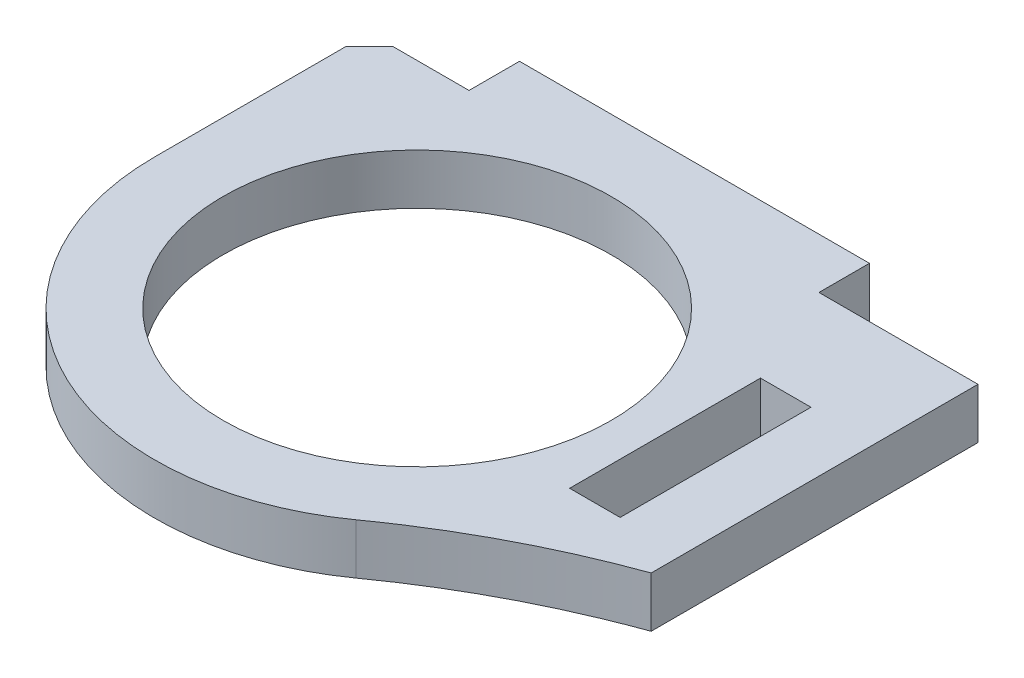
from build123d import *

# Parameters (mm, degrees)
BOSS_EXTRUDE1_DEPTH = 3.175
SKETCH2_W           = 3.175
SKETCH2_H           = 14
BOSS_EXTRUDE2_DEPTH = 3.175
BOSS_EXTRUDE3_DEPTH = 3.175
CUT_EXTRUDE2_START  = -10
CUT_EXTRUDE2_DEPTH  = 10
FILLET1_R           = 50
SKETCH6_W           = 6.875
SKETCH6_H           = 3.175
BOSS_EXTRUDE5_DEPTH = 3.11351312
SKETCH7_W           = 11.175
SKETCH7_H           = 3.175
SKETCH7_W_2         = 4.3
CUT_EXTRUDE3_DEPTH  = 5.11351312
BOSS_EXTRUDE6_START = -3.175
BOSS_EXTRUDE6_DEPTH = 3.175
SKETCH9_W           = 3.175
SKETCH9_H           = 14
BOSS_EXTRUDE7_DEPTH = 3.175
SKETCH10_W          = 3.175
SKETCH10_H          = 12
CUT_EXTRUDE4_DEPTH  = 3.175
CUT_EXTRUDE5_DEPTH  = 10
SKETCH14_W          = 22
SKETCH14_H          = 3.175
BOSS_EXTRUDE8_DEPTH = 3.175
CHAMFER1_SIZE       = 1.5


with BuildPart() as part:
    # Sketch1 → Boss-Extrude1 (new body)
    with BuildSketch(Plane(origin=(0, 0, 0), x_dir=(1, 0, 0), z_dir=(0, 1, 0))):
        with BuildLine():
            ThreePointArc((-16.5, 0), (0, -16.5), (16.5, 0))
            Line((16.5, 0), (16.5, 18.61351312))
            Line((16.5, 18.61351312), (12.2, 18.61351312))
            Line((12.2, 18.61351312), (12.2, 0))
            ThreePointArc((12.2, 0), (0, -12.2), (-12.2, 0))
            Line((-12.2, 0), (-12.2, 18))
            Line((-12.2, 18), (-16.5, 18))
            Line((-16.5, 18), (-16.5, 0))
        make_face()
    extrude(amount=BOSS_EXTRUDE1_DEPTH)

    # Sketch2 → Boss-Extrude2 (add)
    with BuildSketch(Plane(origin=(0, 3.175, 0), x_dir=(1, 0, 0), z_dir=(0, 1, 0))):
        with BuildLine():
            Line((15.2, -3.034798181), (15.2, -4.5))
            Line((15.2, -4.5), (15.874507866, -4.5))
            Line((15.874507866, -4.5), (23.375, -4.5))
            Line((23.375, -4.5), (23.375, 15.5))
            Line((23.375, 15.5), (15.2, 15.5))
            Line((15.2, 15.5), (15.2, 3.034798181))
            ThreePointArc((15.2, 3.034798181), (15.424817665, 1.524795068), (15.5, 0))
            ThreePointArc((15.5, 0), (15.424817665, -1.524795068), (15.2, -3.034798181))
        make_face()
        with Locations((18.0875, 4.5)):
            Rectangle(SKETCH2_W, SKETCH2_H, mode=Mode.SUBTRACT)
    extrude(amount=-BOSS_EXTRUDE2_DEPTH)

    # Sketch3 → Boss-Extrude3 (add)
    with BuildSketch(Plane(origin=(0, 0, 0), x_dir=(-1, 0, 0), z_dir=(0, -1, 0))):
        with BuildLine():
            Line((-23.375, -16.5), (0, -16.5))
            ThreePointArc((0, -16.5), (-9.949874371, -13.162446581), (-15.874507866, -4.5))
            Line((-15.874507866, -4.5), (-23.375, -4.5))
            Line((-23.375, -4.5), (-23.375, -16.5))
        make_face()
    extrude(amount=-BOSS_EXTRUDE3_DEPTH)

    # Sketch5 → Cut-Extrude2 (cut)
    with BuildSketch(Plane(origin=(0, 3.175, 0), x_dir=(1, 0, 0), z_dir=(0, 1, 0)).offset(CUT_EXTRUDE2_START)):
        with BuildLine():
            Line((23.375, -6.5), (19.675, -6.5))
            Line((19.675, -6.5), (17.491400843, -6.5))
            Line((17.491400843, -6.5), (15.165750888, -6.5))
            ThreePointArc((15.165750888, -6.5), (9.082951062, -13.774977314), (0, -16.5))
            Line((0, -16.5), (12.165525061, -16.5))
            Line((12.165525061, -16.5), (23.375, -16.5))
            Line((23.375, -16.5), (23.375, -6.5))
        make_face()
    extrude(amount=CUT_EXTRUDE2_DEPTH, mode=Mode.SUBTRACT)

    # Fillet1
    # the kernel refuses this fillet: 50 mm, written as the material it adds along each edge
    with BuildSketch(Plane(origin=(15.165750888, 0, 6.5), x_dir=(-0.6269455789999085, 0, 0.7790630532713443), z_dir=(0, 1, 0))) as fillet1_piece_1:
        with BuildLine():
            CenterArc((22.355625569, 48.152189259), FILLET1_R, 236.629724146, 17.744988352)
            Line((-5.146752438, 6.395522678), (-5.696799998, 5.560389347))
            ThreePointArc((-5.696799998, 5.560389347), (-3.352439272, 2.57081576), (-0.779063053, -0.626945579))
            Line((-0.779063053, -0.626945579), (0.269344886, -0.963043785))
            ThreePointArc((0.269344886, -0.963043785), (4.444190625, -0.390222456), (8.619036364, -0.963043785))
            Line((8.619036364, -0.963043785), (8.88838125, 0))
        make_face()
    extrude(amount=3.175)

    # Sketch6 → Boss-Extrude5 (add)
    with BuildSketch(Plane(origin=(0, 0, -15.5), x_dir=(-1, 0, 0), z_dir=(0, 0, -1))):
        with Locations((-19.9375, 1.5875)):
            Rectangle(SKETCH6_W, SKETCH6_H)
    extrude(amount=BOSS_EXTRUDE5_DEPTH)

    # Sketch7 → Cut-Extrude3 (cut)
    with BuildSketch(Plane(origin=(0, 0, -18.61351312), x_dir=(-1, 0, 0), z_dir=(0, 0, -1))):
        with Locations((-17.7875, 1.5875)):
            Rectangle(SKETCH7_W, SKETCH7_H)
        with Locations((14.35, 1.5875)):
            Rectangle(SKETCH7_W_2, SKETCH7_H)
    extrude(amount=-CUT_EXTRUDE3_DEPTH, mode=Mode.SUBTRACT)

    # Sketch8 → Boss-Extrude6 (add)
    with BuildSketch(Plane(origin=(0, 3.175, 0), x_dir=(1, 0, 0), z_dir=(0, 1, 0)).offset(BOSS_EXTRUDE6_START)):
        with BuildLine():
            Line((-12.2, 13.5), (-12.2, 0))
            ThreePointArc((-12.2, 0), (0, 12.2), (12.2, 0))
            Line((12.2, 0), (12.2, 13.5))
            Line((12.2, 13.5), (-12.2, 13.5))
        make_face()
    extrude(amount=BOSS_EXTRUDE6_DEPTH)

    # Sketch9 → Boss-Extrude7 (add)
    with BuildSketch(Plane(origin=(0, 0, 0), x_dir=(-1, 0, 0), z_dir=(0, -1, 0))):
        with Locations((-18.0875, 4.5)):
            Rectangle(SKETCH9_W, SKETCH9_H)
    extrude(amount=-BOSS_EXTRUDE7_DEPTH)

    # Sketch10 → Cut-Extrude4 (cut)
    with BuildSketch(Plane(origin=(0, 0, 0), x_dir=(-1, 0, 0), z_dir=(0, -1, 0))):
        with Locations((-16.17406463, 1)):
            Rectangle(SKETCH10_W, SKETCH10_H)
    extrude(amount=-CUT_EXTRUDE4_DEPTH, mode=Mode.SUBTRACT)

    # Sketch12 → Cut-Extrude5 (cut)
    with BuildSketch(Plane(origin=(0, 0, 0), x_dir=(-1, 0, 0), z_dir=(0, -1, 0))):
        with BuildLine():
            Line((-21.76156463, -7.048663108), (-21.76156463, 13.5))
            Line((-21.76156463, 13.5), (-23.375, 13.5))
            Line((-23.375, 13.5), (-23.375, -6.5))
            ThreePointArc((-23.375, -6.5), (-22.565944603, -6.767457123), (-21.76156463, -7.048663108))
        make_face()
    extrude(amount=-CUT_EXTRUDE5_DEPTH, mode=Mode.SUBTRACT)

    # Sketch14 → Boss-Extrude8 (add)
    with BuildSketch(Plane(origin=(0, 0, -13.5), x_dir=(-1, 0, 0), z_dir=(0, 0, -1))):
        with Locations((-0.76156463, 1.5875)):
            Rectangle(SKETCH14_W, SKETCH14_H)
    extrude(amount=BOSS_EXTRUDE8_DEPTH)

    # Chamfer1
    chamfer1_edges = [part.edges().sort_by_distance(p)[0] for p in [
        (-16.5, 1.5875, -13.5),
    ]]
    chamfer(chamfer1_edges, length=CHAMFER1_SIZE)


solid = part.part
